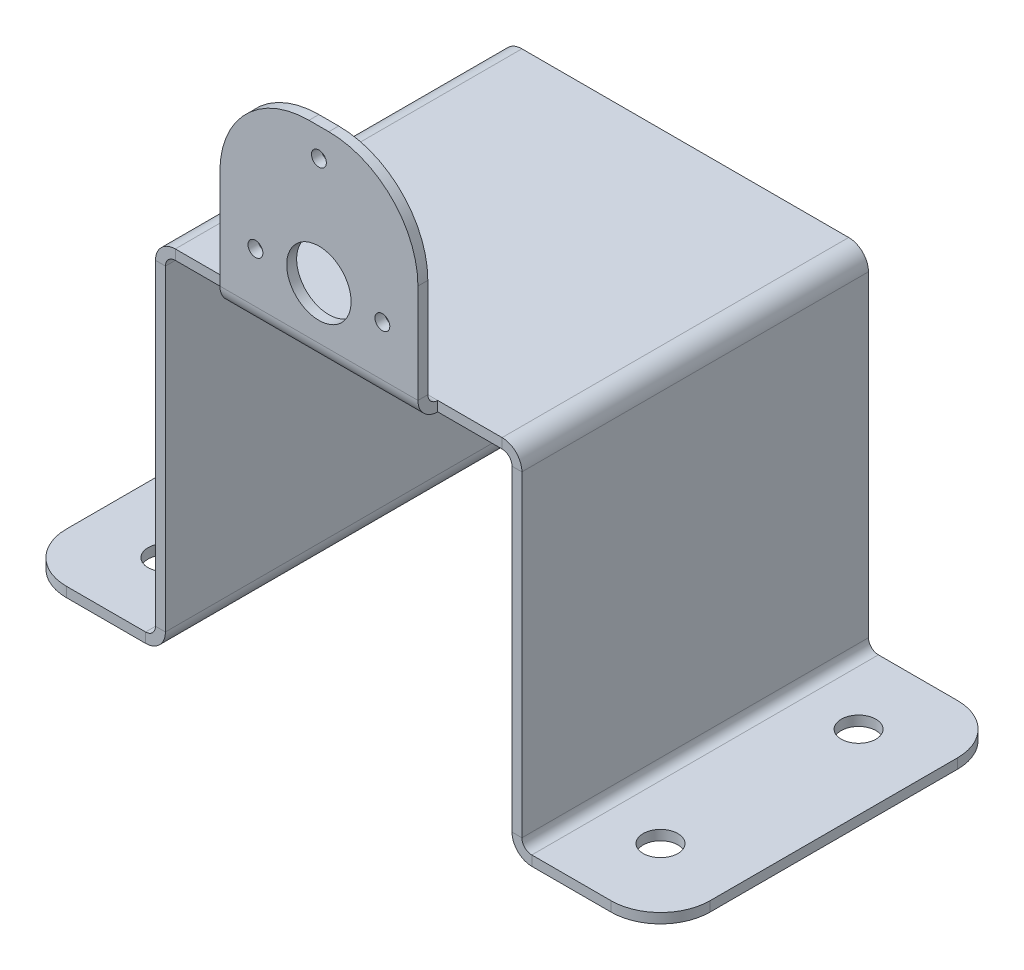
from build123d import *

# Parameters (mm, degrees)
BASE_FLANGE1_DEPTH      = 70
FILLET1_R               = 10
SKETCH6_R               = 3.5
CUT_EXTRUDE1_DEPTH      = 10
EDGE_FLANGE2_DEPTH      = 40
EDGE_FLANGE2_START      = 2
EDGE_FLANGE2_FLAT_DEPTH = 2
SKETCH14_R              = 1.5
CUT_EXTRUDE2_DEPTH      = 10


# Sheet-metal steps are written as plain solids
with BuildPart() as part:
    # Sketch1 → Base-Flange1 (new body)
    with BuildSketch(Plane.XY):
        with BuildLine():
            Line((-65, 0), (-39, 0))
            ThreePointArc((-39, 0), (-36.171572875, 1.171572875), (-35, 4))
            Line((-35, 4), (-35, 68))
            ThreePointArc((-35, 68), (-34.414213562, 69.414213562), (-33, 70))
            Line((-33, 70), (33, 70))
            ThreePointArc((33, 70), (34.414213562, 69.414213562), (35, 68))
            Line((35, 68), (35, 4))
            ThreePointArc((35, 4), (36.171572875, 1.171572875), (39, 0))
            Line((39, 0), (65, 0))
            Line((65, 0), (65, 2))
            Line((65, 2), (39, 2))
            ThreePointArc((39, 2), (37.585786438, 2.585786438), (37, 4))
            Line((37, 4), (37, 68))
            ThreePointArc((37, 68), (35.828427125, 70.828427125), (33, 72))
            Line((33, 72), (-33, 72))
            ThreePointArc((-33, 72), (-35.828427125, 70.828427125), (-37, 68))
            Line((-37, 68), (-37, 4))
            ThreePointArc((-37, 4), (-37.585786438, 2.585786438), (-39, 2))
            Line((-39, 2), (-65, 2))
            Line((-65, 2), (-65, 0))
        make_face()
    extrude(amount=BASE_FLANGE1_DEPTH)

    # Fillet1
    fillet1_edges = [part.edges().sort_by_distance(p)[0] for p in [
        (65, 1, 0),
        (-65, 1, 0),
        (65, 1, 70),
        (-65, 1, 70),
    ]]
    fillet(fillet1_edges, radius=FILLET1_R)

    # Sketch6 → Cut-Extrude1 (cut)
    with BuildSketch(Plane(origin=(0, 2, 0), x_dir=(1, 0, 0), z_dir=(0, 1, 0))):
        with Locations(Location((-50, -15, 0), (0, 0, 180))):
            Circle(SKETCH6_R)
        with Locations(Location((-50, -55, 0), (0, 0, 180))):
            Circle(SKETCH6_R)
        with Locations((50, -55)):
            Circle(SKETCH6_R)
        with Locations((50, -15)):
            Circle(SKETCH6_R)
    extrude(amount=-CUT_EXTRUDE1_DEPTH, mode=Mode.SUBTRACT)

    # Edge-Flange2 bend section (across the edge) → Edge-Flange2 (add)
    with BuildSketch(Plane(origin=(-20, 72, 72), x_dir=(0, 0, -1), z_dir=(1, 0, 0))):
        with BuildLine():
            Line((-2, 2), (0, 2))
            ThreePointArc((0, 2), (0.585786438, 0.585786438), (2, 0))
            Line((2, 0), (2, -2))
            ThreePointArc((2, -2), (-0.828427125, -0.828427125), (-2, 2))
        make_face()
    extrude(amount=EDGE_FLANGE2_DEPTH)

    # Edge-Flange2 profile (on flange) → Edge-Flange2 flat (add)
    with BuildSketch(Plane(origin=(0, 72, 72), x_dir=(1, 0, 0), z_dir=(0, 0, 1)).offset(EDGE_FLANGE2_START)):
        with BuildLine():
            ThreePointArc((20, 22), (14.727922061, 34.727922061), (2, 40))
            Line((2, 40), (-2, 40))
            ThreePointArc((-2, 40), (-14.727922061, 34.727922061), (-20, 22))
            Line((-20, 22), (-20, 2))
            Line((-20, 2), (20, 2))
            Line((20, 2), (20, 22))
        make_face()
    extrude(amount=-EDGE_FLANGE2_FLAT_DEPTH)

    # Sketch14 → Cut-Extrude2 (cut)
    with BuildSketch(Plane.XY.offset(74)):
        with Locations((0, 106.30073689)):
            Circle(SKETCH14_R)
        with Locations((-12.817814143, 84.099631551)):
            Circle(SKETCH14_R)
        with Locations((12.817814144, 84.099631551)):
            Circle(SKETCH14_R)
        with BuildLine():
            ThreePointArc((0, 90.999999997), (-6.5, 84.499999998), (-1e-09, 77.999999997))
            ThreePointArc((-1e-09, 77.999999997), (6.5, 84.499999997), (0, 90.999999997))
        make_face()
    extrude(amount=-CUT_EXTRUDE2_DEPTH, mode=Mode.SUBTRACT)


solid = part.part
